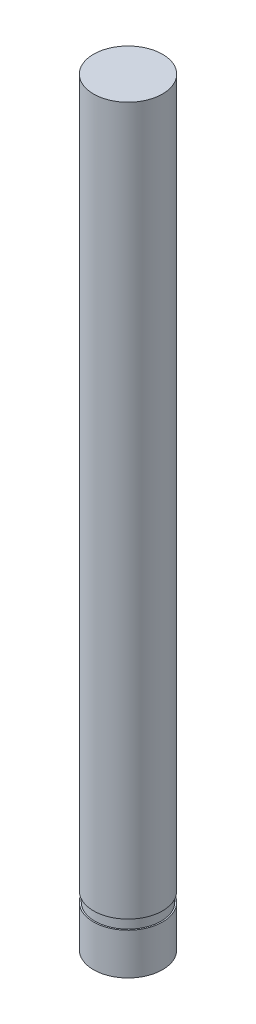
from build123d import *

# Parameters (mm, degrees)
SKETCH1_R           = 2.5
BOSS_EXTRUDE1_DEPTH = 55.000000076
SKETCH2_R           = 2.5
SKETCH2_R_2         = 2.4
CUT_EXTRUDE1_DEPTH  = 0.7


with BuildPart() as part:
    # Sketch1 → Boss-Extrude1 (new body)
    with BuildSketch(Plane(origin=(0, 0, 0), x_dir=(1, 0, 0), z_dir=(0, 1, 0))):
        Circle(SKETCH1_R)
    extrude(amount=BOSS_EXTRUDE1_DEPTH)

    # Sketch2 → Cut-Extrude1 (cut)
    with BuildSketch(Plane(origin=(0, 3.000000096, 0), x_dir=(-1, 0, 0), z_dir=(0, -1, 0))):
        Circle(SKETCH2_R)
        Circle(SKETCH2_R_2, mode=Mode.SUBTRACT)
    extrude(amount=-CUT_EXTRUDE1_DEPTH, mode=Mode.SUBTRACT)


solid = part.part
